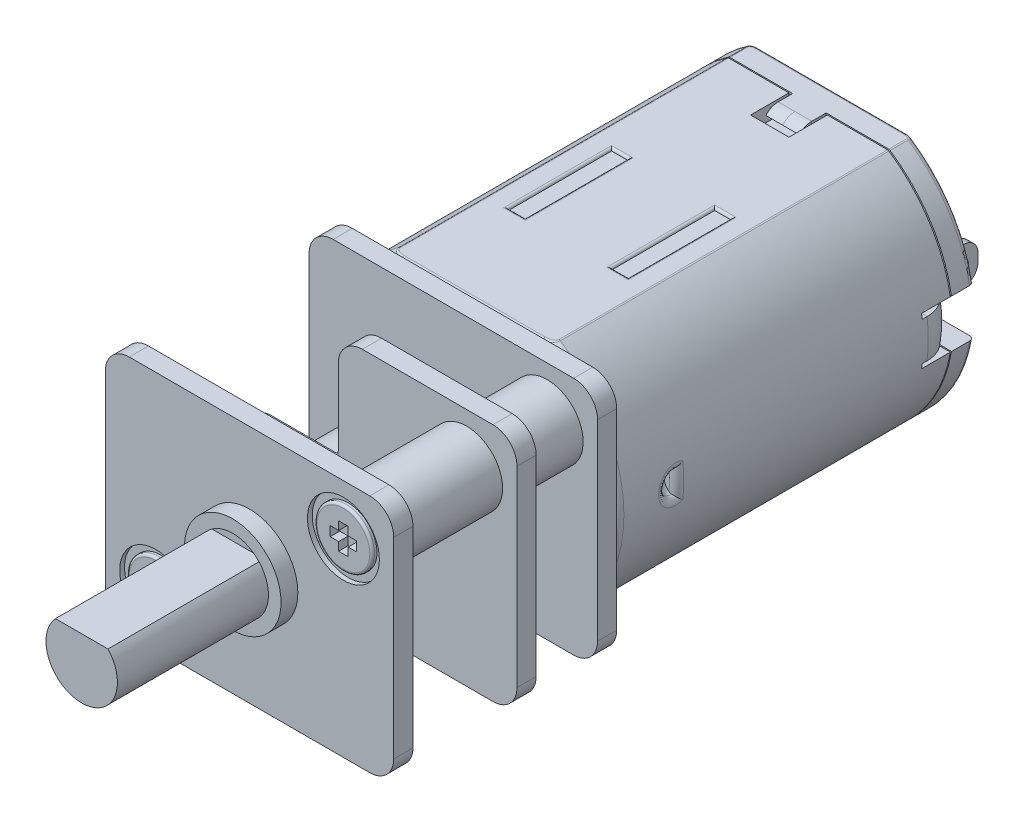
from build123d import *

# Parameters (mm, degrees)
SALIENTE_EXTRUIR2_DEPTH  = 7
SALIENTE_EXTRUIR4_DEPTH  = 0.05
SALIENTE_EXTRUIR5_DEPTH  = 0.95
REDONDEO1_R              = 0.2
CROQUIS4_R               = 2.515
SALIENTE_EXTRUIR6_DEPTH  = 1.15
CROQUIS5_R               = 1
CORTAR_EXTRUIR1_DEPTH    = 0.7
CROQUIS6_W               = 1.6
CROQUIS6_H               = 1.6
CORTAR_EXTRUIR2_DEPTH    = 0.6
CROQUIS9_W               = 1.5
CROQUIS9_H               = 2
CORTAR_EXTRUIR3_DEPTH    = 2.2
CROQUIS12_W              = 0.7
CROQUIS12_H              = 4.3
CORTAR_EXTRUIR4_DEPTH    = 0.1
REDONDEO2_R              = 0.1
CROQUIS13_W              = 0.7
CROQUIS13_H              = 4.3
CORTAR_EXTRUIR5_DEPTH    = 0.1
REDONDEO3_R              = 0.1
CORTAR_REVOLUCI_N2_ANGLE = 180
REDONDEO4_R              = 0.3
REDONDEO5_R              = 0.3
REDONDEO6_R              = 0.3
REDONDEO7_R              = 0.1
REDONDEO8_R              = 0.1
CROQUIS15_W              = 12.03
CROQUIS15_H              = 10
SALIENTE_EXTRUIR8_DEPTH  = 0.8
REDONDEO9_R              = 0.1
CROQUIS16_R              = 1.5
SALIENTE_EXTRUIR9_DEPTH  = 8.5
CROQUIS17_W              = 12.03
CROQUIS17_H              = 10
SALIENTE_EXTRUIR10_DEPTH = 0.8
SALIENTE_EXTRUIR11_DEPTH = 0.8
REDONDEO10_R             = 1
CROQUIS19_R              = 2.015
SALIENTE_EXTRUIR12_DEPTH = 0.7
SALIENTE_EXTRUIR13_START = 2.62
CROQUIS20_R              = 2.015
SALIENTE_EXTRUIR13_DEPTH = 2.62
SALIENTE_EXTRUIR14_DEPTH = 9
CORTAR_EXTRUIR6_START    = -0.2
CROQUIS22_R              = 1.5
CORTAR_EXTRUIR6_DEPTH    = 0.2
CROQUIS23_R              = 1.2
SALIENTE_EXTRUIR15_DEPTH = 0.2
CORTAR_EXTRUIR7_DEPTH    = 0.4
REDONDEO11_R             = 0.1
CORTAR_EXTRUIR8_START    = -0.2
CORTAR_EXTRUIR8_DEPTH    = 0.2
CROQUIS26_W              = 0.3
CROQUIS26_H              = 1.53
SALIENTE_EXTRUIR16_DEPTH = 2
CROQUIS27_W              = 1.2
CROQUIS27_H              = 0.73
CORTAR_EXTRUIR9_DEPTH    = 0.3
REDONDEO12_R             = 0.6
REDONDEO13_R             = 0.4
CORTAR_EXTRUIR10_DEPTH   = 0.3
REDONDEO14_R             = 0.6
CUT_EXTRUDE1_START       = -2.7
CUT_EXTRUDE1_DEPTH       = 2.7


# Some blends are built 0.0001 mm under size
with BuildPart() as part:
    # Croquis1 → Saliente-Extruir2 (new, symmetric)
    with BuildSketch(Plane.XY):
        with BuildLine():
            Line((-3.343684345, 5), (3.343684345, 5))
            ThreePointArc((3.343684345, 5), (6.015, 0), (3.343684345, -5))
            Line((3.343684345, -5), (-3.343684345, -5))
            ThreePointArc((-3.343684345, -5), (-6.015, 0), (-3.343684345, 5))
        make_face()
    extrude(amount=SALIENTE_EXTRUIR2_DEPTH, both=True)

    # Croquis2 → Saliente-Extruir4 (add)
    with BuildSketch(Plane(origin=(0, 0, -7), x_dir=(-1, 0, 0), z_dir=(0, 0, -1))):
        with BuildLine():
            Line((-3.091314445, -4.2), (3.091314445, -4.2))
            ThreePointArc((3.091314445, -4.2), (5.215, 0), (3.091314445, 4.2))
            Line((3.091314445, 4.2), (-3.091314445, 4.2))
            ThreePointArc((-3.091314445, 4.2), (-5.215, 0), (-3.091314445, -4.2))
        make_face()
    extrude(amount=SALIENTE_EXTRUIR4_DEPTH)

    # Croquis3 → Saliente-Extruir5 (add)
    with BuildSketch(Plane(origin=(0, 0, -7.05), x_dir=(-1, 0, 0), z_dir=(0, 0, -1))):
        with BuildLine():
            Line((-3.343684345, -5), (3.343684345, -5))
            ThreePointArc((3.343684345, -5), (6.015, 0), (3.343684345, 5))
            Line((3.343684345, 5), (-3.343684345, 5))
            ThreePointArc((-3.343684345, 5), (-6.015, 0), (-3.343684345, -5))
        make_face()
    extrude(amount=SALIENTE_EXTRUIR5_DEPTH)

    # Redondeo1
    redondeo1_edges = [part.edges().sort_by_distance(p)[0] for p in [
        (6.015, 0, -8),
        (-6.015, 0, -8),
    ]]
    fillet(redondeo1_edges, radius=REDONDEO1_R)

    # Croquis4 → Saliente-Extruir6 (add)
    with BuildSketch(Plane(origin=(0, 0, -8), x_dir=(-1, 0, 0), z_dir=(0, 0, -1))):
        Circle(CROQUIS4_R)
    extrude(amount=SALIENTE_EXTRUIR6_DEPTH)

    # Croquis5 → Cortar-Extruir1 (cut)
    with BuildSketch(Plane(origin=(0, 0, -9.15), x_dir=(-1, 0, 0), z_dir=(0, 0, -1))):
        Circle(CROQUIS5_R)
    extrude(amount=-CORTAR_EXTRUIR1_DEPTH, mode=Mode.SUBTRACT)

    # Croquis6 → Cortar-Extruir2 (cut)
    with BuildSketch(Plane(origin=(0, 5, 0), x_dir=(1, 0, 0), z_dir=(0, 1, 0))):
        with Locations((0, 6.2)):
            Rectangle(CROQUIS6_W, CROQUIS6_H)
    extrude(amount=-CORTAR_EXTRUIR2_DEPTH, mode=Mode.SUBTRACT)

    # Barrer1: sweep along a path in Croquis8
    with BuildLine(Plane(origin=(0, 0, 0), x_dir=(0, 0, -1), z_dir=(1, 0, 0))) as barrer1_path:
        Line((7.05, 4.8), (6.45, 4.8))
        ThreePointArc((6.45, 4.8), (6.2516861, 4.756520534), (6.08975411, 4.634058714))
    # Croquis7 → Barrer1 (sweep)
    with BuildSketch(Plane.XY.offset(-7.05)):
        Polygon((0, 5), (-0.7, 5), (-0.7, 4.6), (0.7, 4.6), (0.7, 5), align=None)
    sweep(path=barrer1_path.line)

    # Croquis9 → Cortar-Extruir3 (cut)
    with BuildSketch(Plane(origin=(0, 0, -8), x_dir=(-1, 0, 0), z_dir=(0, 0, -1))):
        with Locations((-5.265, 0)):
            Rectangle(CROQUIS9_W, CROQUIS9_H)
    cortar_extruir3 = extrude(amount=-CORTAR_EXTRUIR3_DEPTH, mode=Mode.SUBTRACT)

    # Barrer2: sweep along a path in Croquis11
    with BuildLine(Plane(origin=(0, 0, 0), x_dir=(1, 0, 0), z_dir=(0, 1, 0))) as barrer2_path:
        Line((5.561562295, 5.8), (5.561562295, 6))
        ThreePointArc((5.561562295, 6), (5.343693941, 6.586560818), (4.795743442, 6.888670836))
    # Croquis10 → Barrer2 (sweep)
    with BuildSketch(Plane(origin=(0, 0, -5.8), x_dir=(-1, 0, 0), z_dir=(0, 0, -1))):
        with BuildLine():
            Line((-5.961562295, 0.8), (-5.161562295, 0.8))
            Line((-5.161562295, 0.8), (-5.161562295, -0.8))
            Line((-5.161562295, -0.8), (-5.961562295, -0.8))
            ThreePointArc((-5.961562295, -0.8), (-6.015, 0), (-5.961562295, 0.8))
        make_face()
    barrer2 = sweep(path=barrer2_path.line)

    # Simetría2: Cortar-Extruir3, Barrer2 across plane
    add(cortar_extruir3.mirror(Plane(origin=(0, 0, 0), x_dir=(0, 0, 1), z_dir=(1, 0, 0))), mode=Mode.SUBTRACT)
    add(barrer2.mirror(Plane(origin=(0, 0, 0), x_dir=(0, 0, 1), z_dir=(1, 0, 0))))

    # Croquis12 → Cortar-Extruir4 (cut)
    with BuildSketch(Plane(origin=(0, 5, 0), x_dir=(1, 0, 0), z_dir=(0, 1, 0))):
        with Locations((-2.15, -0.85)):
            Rectangle(CROQUIS12_W, CROQUIS12_H)
        with Locations((2.15, -0.85)):
            Rectangle(CROQUIS12_W, CROQUIS12_H)
    extrude(amount=-CORTAR_EXTRUIR4_DEPTH, mode=Mode.SUBTRACT)

    # Redondeo2
    redondeo2_edges = [part.edges().sort_by_distance(p)[0] for p in [
        (2.15, 5, 3),
        (2.5, 5, 0.85),
        (1.8, 5, 0.85),
        (2.15, 5, -1.3),
        (-1.8, 5, 0.85),
        (-2.5, 5, 0.85),
        (-2.15, 5, 3),
        (-2.15, 5, -1.3),
    ]]
    fillet(redondeo2_edges, radius=REDONDEO2_R - 0.0001)  # a hair under: the kernel refuses the full size

    # Croquis13 → Cortar-Extruir5 (cut)
    with BuildSketch(Plane.XZ.offset(5)):
        with Locations((2.15, 0.85)):
            Rectangle(CROQUIS13_W, CROQUIS13_H)
        with Locations((-2.15, 0.85)):
            Rectangle(CROQUIS13_W, CROQUIS13_H)
    extrude(amount=-CORTAR_EXTRUIR5_DEPTH, mode=Mode.SUBTRACT)

    # Redondeo3
    redondeo3_edges = [part.edges().sort_by_distance(p)[0] for p in [
        (-2.15, -5, 3),
        (-2.5, -5, 0.85),
        (-2.15, -5, -1.3),
        (-1.8, -5, 0.85),
        (2.15, -5, 3),
        (1.8, -5, 0.85),
        (2.5, -5, 0.85),
        (2.15, -5, -1.3),
    ]]
    fillet(redondeo3_edges, radius=REDONDEO3_R - 0.0001)  # a hair under: the kernel refuses the full size

    # Croquis14 → Cortar-Revolución2 (revolve, cut)
    with BuildSketch(Plane.XY.offset(4.5)):
        with BuildLine():
            Line((5.994325701, 0.498281438), (5.994325701, -0.498281438))
            ThreePointArc((5.994325701, -0.498281438), (5.496044263, 0), (5.994325701, 0.498281438))
        make_face()
    cortar_revoluci_n2 = revolve(axis=Axis((5.994325701, 0.498281438, 4.5), (0, 1, 0)), revolution_arc=CORTAR_REVOLUCI_N2_ANGLE, mode=Mode.SUBTRACT)

    # Redondeo4
    redondeo4_edges = [part.edges().sort_by_distance(p)[0] for p in [
        (6.015, 0, 4.5),
        (6.015, 0, 4.997852353),
    ]]
    fillet(redondeo4_edges, radius=REDONDEO4_R)

    # Simetría10: Cortar-Revolución2 across plane
    add(cortar_revoluci_n2.mirror(Plane(origin=(0, 0, 0), x_dir=(0, 0, 1), z_dir=(1, 0, 0))), mode=Mode.SUBTRACT)

    # Redondeo5
    redondeo5_edges = [part.edges().sort_by_distance(p)[0] for p in [
        (-6.015, 0, 4.5),
        (-6.015, 0, 4.997852353),
    ]]
    fillet(redondeo5_edges, radius=REDONDEO5_R)

    # Redondeo6
    redondeo6_edges = [part.edges().sort_by_distance(p)[0] for p in [
        (-6.015, 0, 7),
        (6.015, 0, 7),
    ]]
    fillet(redondeo6_edges, radius=REDONDEO6_R)

    # Redondeo7
    redondeo7_edges = [part.edges().sort_by_distance(p)[0] for p in [
        (0, 5, 7),
        (-3.343684345, 5, -0.15),
        (3.343684345, 5, -0.15),
        (3.115222831, 5, 6.942903517),
        (-3.115222831, 5, 6.942903517),
    ]]
    fillet(redondeo7_edges, radius=REDONDEO7_R)

    # Redondeo8
    redondeo8_edges = [part.edges().sort_by_distance(p)[0] for p in [
        (0, -5, 7),
        (3.343684345, -5, -0.15),
        (-3.343684345, -5, -0.15),
        (3.115222831, -5, 6.942903517),
        (-3.115222831, -5, 6.942903517),
    ]]
    fillet(redondeo8_edges, radius=REDONDEO8_R)

    # Croquis15 → Saliente-Extruir8 (add)
    with BuildSketch(Plane.XY.offset(7)):
        Rectangle(CROQUIS15_W, CROQUIS15_H)
    extrude(amount=SALIENTE_EXTRUIR8_DEPTH)

    # Redondeo9
    redondeo9_edges = [part.edges().sort_by_distance(p)[0] for p in [
        (0, -5, -8),
        (0, 5, -8),
        (3.343684345, 5, -7.425),
        (-3.343684345, 5, -7.425),
        (3.195717986, 5, -7.960729085),
        (-3.195717986, 5, -7.960729085),
        (-3.343684345, -5, -7.425),
        (3.343684345, -5, -7.425),
        (3.195717986, -5, -7.960729085),
        (-3.195717986, -5, -7.960729085),
    ]]
    fillet(redondeo9_edges, radius=REDONDEO9_R)

    # Croquis16 → Saliente-Extruir9 (add)
    with BuildSketch(Plane.XY.offset(7.8)):
        with Locations(Location((3.915, 2.9, 0), (0, 0, 180))):
            Circle(CROQUIS16_R)
        with Locations(Location((-3.915, -2.9, 0), (0, 0, 180))):
            Circle(CROQUIS16_R)
    extrude(amount=SALIENTE_EXTRUIR9_DEPTH)

    # Croquis17 → Saliente-Extruir10 (add)
    with BuildSketch(Plane.XY.offset(16.3)):
        Rectangle(CROQUIS17_W, CROQUIS17_H)
    extrude(amount=-SALIENTE_EXTRUIR10_DEPTH)

    # Croquis18 → Saliente-Extruir11 (add)
    with BuildSketch(Plane.XY.offset(11.16)):
        Polygon((-6.015, -0.09), (-1.435, -0.09), (-1.435, 5), (6.015, 5), (6.015, -5), (-6.015, -5), align=None)
    extrude(amount=-SALIENTE_EXTRUIR11_DEPTH)

    # Redondeo10
    redondeo10_edges = [part.edges().sort_by_distance(p)[0] for p in [
        (6.015, -5, 7.4),
        (6.015, 5, 7.4),
        (-6.015, 5, 7.4),
        (-6.015, -5, 7.4),
        (6.015, -5, 15.9),
        (-6.015, -5, 15.9),
        (-6.015, 5, 15.9),
        (6.015, 5, 15.9),
        (6.015, -5, 10.76),
        (-6.015, -5, 10.76),
        (-6.015, -0.09, 10.76),
        (-1.435, -0.09, 10.76),
        (-1.435, 5, 10.76),
        (6.015, 5, 10.76),
    ]]
    fillet(redondeo10_edges, radius=REDONDEO10_R)

    # Croquis19 → Saliente-Extruir12 (add)
    with BuildSketch(Plane.XY.offset(16.3)):
        Circle(CROQUIS19_R)
    extrude(amount=SALIENTE_EXTRUIR12_DEPTH)

    # Croquis20 → Saliente-Extruir13 (add)
    with BuildSketch(Plane(origin=(0, 0, 15.5), x_dir=(-1, 0, 0), z_dir=(0, 0, -1)).offset(SALIENTE_EXTRUIR13_START)):
        with Locations(Location((0, 0, 0), (0, 0, 180))):
            Circle(CROQUIS20_R)
    extrude(amount=-SALIENTE_EXTRUIR13_DEPTH)

    # Croquis21 → Saliente-Extruir14 (add)
    with BuildSketch(Plane.XY.offset(17)):
        with BuildLine():
            Line((-1.095445115, 1.01), (1.095445115, 1.01))
            ThreePointArc((1.095445115, 1.01), (0, -1.49), (-1.095445115, 1.01))
        make_face()
    extrude(amount=SALIENTE_EXTRUIR14_DEPTH)

    # Croquis22 → Cortar-Extruir6 (cut)
    with BuildSketch(Plane.XY.offset(16.3).offset(CORTAR_EXTRUIR6_START)):
        with Locations(Location((3.915, 2.9, 0), (0, 0, 180))):
            Circle(CROQUIS22_R)
        with Locations(Location((-3.915, -2.9, 0), (0, 0, 180))):
            Circle(CROQUIS22_R)
    extrude(amount=CORTAR_EXTRUIR6_DEPTH, mode=Mode.SUBTRACT)

    # Croquis23 → Saliente-Extruir15 (add)
    with BuildSketch(Plane.XY.offset(16.1)):
        with Locations((3.915, 2.9)):
            Circle(CROQUIS23_R)
        with Locations((-3.915, -2.9)):
            Circle(CROQUIS23_R)
    extrude(amount=SALIENTE_EXTRUIR15_DEPTH)

    # Croquis24 → Cortar-Extruir7 (cut)
    with BuildSketch(Plane.XY.offset(16.3)):
        Polygon((-4.465, -3.1), (-4.115, -3.1), (-4.115, -3.45), (-3.715, -3.45), (-3.715, -3.1), (-3.365, -3.1), (-3.365, -2.7), (-3.715, -2.7), (-3.715, -2.35), (-4.115, -2.35), (-4.115, -2.7), (-4.465, -2.7), align=None)
        Polygon((3.365, 2.7), (3.715, 2.7), (3.715, 2.35), (4.115, 2.35), (4.115, 2.7), (4.465, 2.7), (4.465, 3.1), (4.115, 3.1), (4.115, 3.45), (3.715, 3.45), (3.715, 3.1), (3.365, 3.1), align=None)
    extrude(amount=-CORTAR_EXTRUIR7_DEPTH, mode=Mode.SUBTRACT)

    # Redondeo11
    redondeo11_edges = [part.edges().sort_by_distance(p)[0] for p in [
        (2.715, 2.9, 16.3),
        (-5.115, -2.9, 16.3),
    ]]
    fillet(redondeo11_edges, radius=REDONDEO11_R)

    # Croquis25 → Cortar-Extruir8 (cut)
    with BuildSketch(Plane.XY.offset(17).offset(CORTAR_EXTRUIR8_START)):
        with BuildLine():
            Line((1.095445115, 1.01), (-1.095445115, 1.01))
            ThreePointArc((-1.095445115, 1.01), (0, 1.49), (1.095445115, 1.01))
        make_face()
    extrude(amount=CORTAR_EXTRUIR8_DEPTH, mode=Mode.SUBTRACT)

    # Croquis26 → Saliente-Extruir16 (add)
    with BuildSketch(Plane(origin=(0, 0, -8), x_dir=(-1, 0, 0), z_dir=(0, 0, -1))):
        with Locations((-3.935, 0)):
            Rectangle(CROQUIS26_W, CROQUIS26_H)
        with Locations((3.935, 0)):
            Rectangle(CROQUIS26_W, CROQUIS26_H)
    extrude(amount=SALIENTE_EXTRUIR16_DEPTH)

    # Croquis27 → Cortar-Extruir9 (cut)
    with BuildSketch(Plane(origin=(4.085, 0, 0), x_dir=(0, 0, -1), z_dir=(1, 0, 0))):
        with Locations((9, 0)):
            Rectangle(CROQUIS27_W, CROQUIS27_H)
    extrude(amount=-CORTAR_EXTRUIR9_DEPTH, mode=Mode.SUBTRACT)

    # Redondeo12
    redondeo12_edges = [part.edges().sort_by_distance(p)[0] for p in [
        (3.935, -0.765, -10),
        (3.935, 0.765, -10),
    ]]
    fillet(redondeo12_edges, radius=REDONDEO12_R)

    # Redondeo13
    # the kernel refuses this fillet: 0.4 mm, written as the material it adds along each edge
    with BuildSketch(Plane(origin=(4.085, 0.365, -8.4), x_dir=(0, 0, -1), z_dir=(-1, 0, 0))) as redondeo13_piece_1:
        with BuildLine():
            CenterArc((REDONDEO13_R, REDONDEO13_R), REDONDEO13_R, 180, 90)
            Line((0, REDONDEO13_R), (0, 0))
            Line((0, 0), (REDONDEO13_R, 0))
        make_face()
    extrude(amount=0.3)
    with BuildSketch(Plane(origin=(4.085, -0.365, -8.4), x_dir=(0, 0, -1), z_dir=(-1, 0, 0)), Plane(origin=(4.085, -0.365, -9.6), x_dir=(0, 1, 0), z_dir=(-1, 0, 0)), Plane(origin=(4.085, 0.365, -9.6), x_dir=(0, 0, 1), z_dir=(-1, 0, 0))) as redondeo13_piece_2:
        with BuildLine():
            CenterArc((REDONDEO13_R, -REDONDEO13_R), REDONDEO13_R, 90, 90)
            Line((0, -REDONDEO13_R), (0, 0))
            Line((0, 0), (REDONDEO13_R, 0))
        make_face()
    extrude(amount=0.3)

    # Croquis28 → Cortar-Extruir10 (cut)
    with BuildSketch(Plane(origin=(-3.785, 0, 0), x_dir=(0, 0, -1), z_dir=(1, 0, 0))):
        with BuildLine():
            Line((9.2, 0.365), (8.8, 0.365))
            ThreePointArc((8.8, 0.365), (8.529814878, 0.259957624), (8.401534192, 0))
            ThreePointArc((8.401534192, 0), (8.529814878, -0.259957624), (8.8, -0.365))
            Line((8.8, -0.365), (9.2, -0.365))
            ThreePointArc((9.2, -0.365), (9.470185122, -0.259957624), (9.598465808, 0))
            ThreePointArc((9.598465808, 0), (9.470185122, 0.259957624), (9.2, 0.365))
        make_face()
    extrude(amount=-CORTAR_EXTRUIR10_DEPTH, mode=Mode.SUBTRACT)

    # Redondeo14
    redondeo14_edges = [part.edges().sort_by_distance(p)[0] for p in [
        (-3.935, -0.765, -10),
        (-3.935, 0.765, -10),
    ]]
    fillet(redondeo14_edges, radius=REDONDEO14_R)

    # Sketch1 → Cut-Extrude1 (cut)
    with BuildSketch(Plane.XY.offset(26).offset(CUT_EXTRUDE1_START)):
        with BuildLine():
            Line((-1.095445115, 1.01), (1.095445115, 1.01))
            ThreePointArc((1.095445115, 1.01), (0, -1.49), (-1.095445115, 1.01))
        make_face()
    extrude(amount=CUT_EXTRUDE1_DEPTH, mode=Mode.SUBTRACT)


solid = part.part
